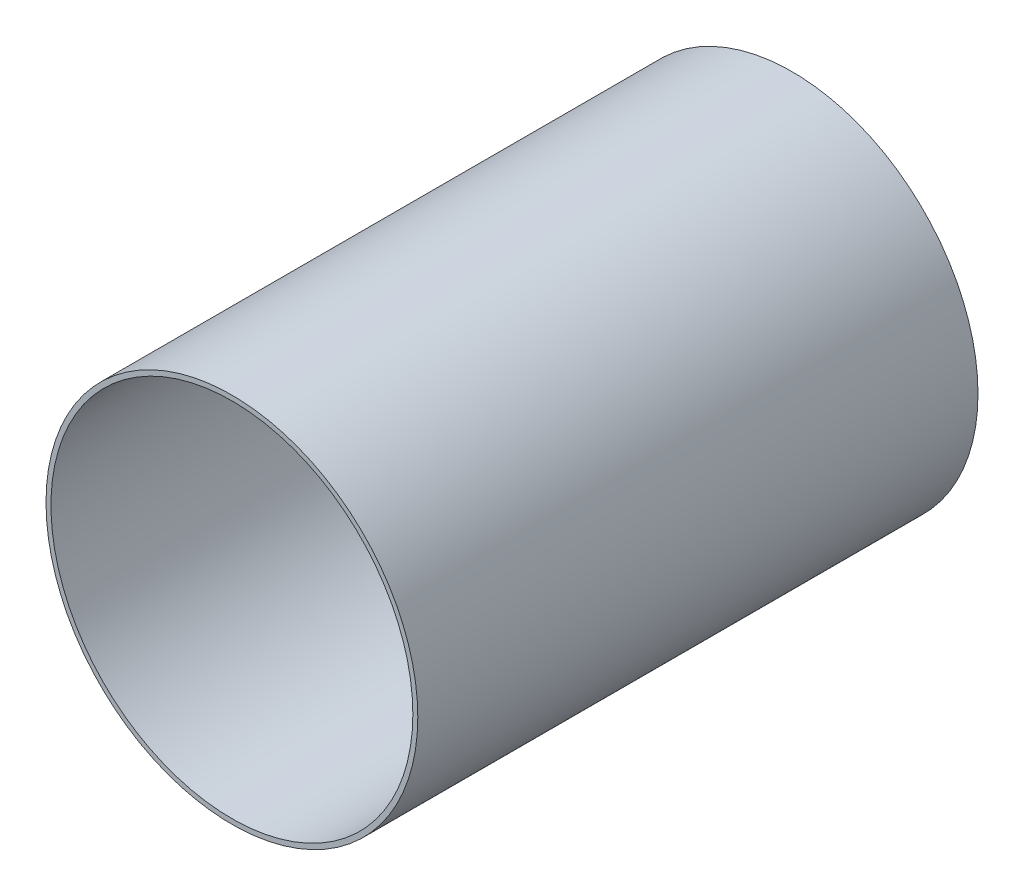
from build123d import *

# Parameters (mm, degrees)
SCHIZZO1_R                = 75
SCHIZZO1_R_2              = 73
ESTRUSIONE_SOTTILE1_DEPTH = 226


with BuildPart() as part:
    # Schizzo1 → Estrusione-Sottile1 (new body)
    with BuildSketch(Plane.XY):
        Circle(SCHIZZO1_R)
        Circle(SCHIZZO1_R_2, mode=Mode.SUBTRACT)
    extrude(amount=ESTRUSIONE_SOTTILE1_DEPTH)


solid = part.part
